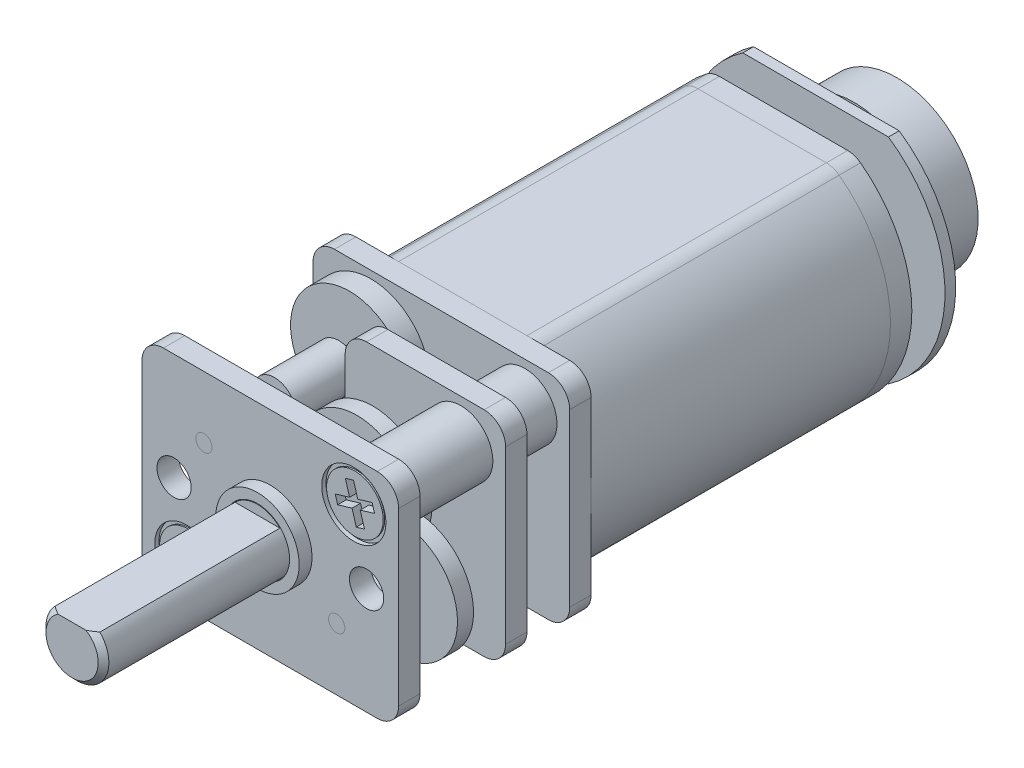
from build123d import *

# Parameters (mm, degrees)
BOSS_EXTRUDE1_DEPTH    = 7.5
FILLET3_R              = 1
BOSS_EXTRUDE2_DEPTH    = 1
BOSS_EXTRUDE3_START    = 9
BOSS_EXTRUDE3_DEPTH    = 1
SKETCH7_R              = 0.5
BOSS_EXTRUDE5_DEPTH    = 8
BOSS_EXTRUDE5_2_DEPTH  = 8
BOSS_EXTRUDE8_START    = 2
BOSS_EXTRUDE8_DEPTH    = 1
CUT_EXTRUDE1_START     = -9
SKETCH5_R              = 0.75
SKETCH5_R_2            = 0.38
CUT_EXTRUDE1_DEPTH     = 9
SKETCH8_R              = 0.5
SKETCH8_R_2            = 0.38
CUT_EXTRUDE2_DEPTH     = 1
BOSS_EXTRUDE6_START    = 0.2
SKETCH9_R              = 2.75
SKETCH9_R_2            = 0.5
BOSS_EXTRUDE6_DEPTH    = 1
BOSS_EXTRUDE16_START   = 0.1
SKETCH9_3_R            = 1
SKETCH9_3_R_2          = 0.75
BOSS_EXTRUDE16_DEPTH   = 1.3
SKETCH6_R              = 1.95
SKETCH6_R_2            = 0.75
BOSS_EXTRUDE4_DEPTH    = 0.6
BOSS_EXTRUDE7_START    = 0.5
SKETCH10_R             = 1
SKETCH10_R_2           = 0.5
BOSS_EXTRUDE7_DEPTH    = 3
SKETCH12_R             = 1.5
SKETCH12_R_2           = 0.75
BOSS_EXTRUDE9_DEPTH    = 2
BOSS_EXTRUDE9_2_DEPTH  = 2
BOSS_EXTRUDE10_START   = 3
SKETCH12_2_R           = 1.5
SKETCH12_2_R_2         = 0.75
BOSS_EXTRUDE10_DEPTH   = 4
BOSS_EXTRUDE10_2_DEPTH = 4
SKETCH13_R             = 1.5
CUT_EXTRUDE3_DEPTH     = 7.2
SKETCH14_R             = 1.5
CUT_EXTRUDE4_DEPTH     = 0.2
CHAMFER1_SIZE          = 0.5
BOSS_EXTRUDE11_START   = 0.2
SKETCH15_R             = 2.75
BOSS_EXTRUDE11_DEPTH   = 0.75
BOSS_EXTRUDE12_START   = 0.2
SKETCH16_R             = 1
BOSS_EXTRUDE12_DEPTH   = 1.15
BOSS_EXTRUDE13_START   = 0.4
SKETCH17_R             = 2.75
BOSS_EXTRUDE13_DEPTH   = 0.75
BOSS_EXTRUDE14_START   = 0.2
SKETCH18_R             = 1
BOSS_EXTRUDE14_DEPTH   = 1.5
SKETCH19_R             = 0.5
CUT_EXTRUDE5_DEPTH     = 25.100622399
SKETCH20_R             = 2.75
BOSS_EXTRUDE15_DEPTH   = 1
CUT_EXTRUDE6_START     = -22.8
SKETCH21_R             = 0.5
CUT_EXTRUDE6_DEPTH     = 24.6
CHAMFER2_SIZE          = 0.25
CUT_EXTRUDE7_DEPTH     = 8.67
SKETCH24_R             = 0.8
CUT_EXTRUDE8_DEPTH     = 1
CUT_EXTRUDE9_START     = -1
CUT_EXTRUDE9_DEPTH     = 1
BOSS_EXTRUDE17_DEPTH   = 1
SKETCH27_R             = 2.5
BOSS_EXTRUDE18_DEPTH   = 1.5
SKETCH28_W             = 0.3
SKETCH28_H             = 1.5
BOSS_EXTRUDE19_DEPTH   = 2
BOSS_EXTRUDE19_2_DEPTH = 2
FILLET1_R              = 0.7
FILLET2_R              = 0.7
CUT_EXTRUDE10_DEPTH    = 0.4
SKETCH31_R             = 0.5
BOSS_EXTRUDE20_DEPTH   = 4
SKETCH32_R             = 0.610179696
BOSS_EXTRUDE21_DEPTH   = 0.5
SKETCH33_R             = 3.8
BOSS_EXTRUDE22_DEPTH   = 2


with BuildPart() as part:
    # Sketch1 → Boss-Extrude1 (new, symmetric)
    with BuildSketch(Plane.XY):
        with BuildLine():
            Line((3.31662479, 5), (-3.31662479, 5))
            ThreePointArc((-3.31662479, 5), (-6, 0), (-3.31662479, -5))
            Line((-3.31662479, -5), (3.31662479, -5))
            ThreePointArc((3.31662479, -5), (6, 0), (3.31662479, 5))
        make_face()
    extrude(amount=BOSS_EXTRUDE1_DEPTH, both=True)

    # Fillet3
    fillet3_edges = [part.edges().sort_by_distance(p)[0] for p in [
        (3.31662479, -5, 0),
        (-3.31662479, -5, 0),
        (-3.31662479, 5, 0),
        (3.31662479, 5, 0),
    ]]
    fillet(fillet3_edges, radius=FILLET3_R)

    # Sketch25 → Cut-Extrude9 (cut)
    with BuildSketch(Plane(origin=(0, 0, -7.5), x_dir=(-1, 0, 0), z_dir=(0, 0, -1)).offset(CUT_EXTRUDE9_START)):
        with BuildLine():
            Line((-3, -5), (3, -5))
            ThreePointArc((3, -5), (3.316227766, -4.948683298), (3.6, -4.8))
            ThreePointArc((3.6, -4.8), (6, 0), (3.6, 4.8))
            ThreePointArc((3.6, 4.8), (3.316227766, 4.948683298), (3, 5))
            Line((3, 5), (-3, 5))
            ThreePointArc((-3, 5), (-3.316227766, 4.948683298), (-3.6, 4.8))
            ThreePointArc((-3.6, 4.8), (-6, 0), (-3.6, -4.8))
            ThreePointArc((-3.6, -4.8), (-3.316227766, -4.948683298), (-3, -5))
        make_face()
    extrude(amount=CUT_EXTRUDE9_DEPTH, mode=Mode.SUBTRACT)


with BuildPart() as body_2:
    # Sketch2 → Boss-Extrude2 (new body)
    with BuildSketch(Plane.XY.offset(7.5)):
        with BuildLine():
            Line((-5, -5), (5, -5))
            ThreePointArc((5, -5), (5.707106781, -4.707106781), (6, -4))
            Line((6, -4), (6, 4))
            ThreePointArc((6, 4), (5.707106781, 4.707106781), (5, 5))
            Line((5, 5), (-5, 5))
            ThreePointArc((-5, 5), (-5.707106781, 4.707106781), (-6, 4))
            Line((-6, 4), (-6, -4))
            ThreePointArc((-6, -4), (-5.707106781, -4.707106781), (-5, -5))
        make_face()
    extrude(amount=BOSS_EXTRUDE2_DEPTH)


with BuildPart() as body_3:
    # Sketch2<2> → Boss-Extrude3 (new body)
    with BuildSketch(Plane.XY.offset(7.5).offset(BOSS_EXTRUDE3_START)):
        with BuildLine():
            Line((-5, -5), (5, -5))
            ThreePointArc((5, -5), (5.707106781, -4.707106781), (6, -4))
            Line((6, -4), (6, 4))
            ThreePointArc((6, 4), (5.707106781, 4.707106781), (5, 5))
            Line((5, 5), (-5, 5))
            ThreePointArc((-5, 5), (-5.707106781, 4.707106781), (-6, 4))
            Line((-6, 4), (-6, -4))
            ThreePointArc((-6, -4), (-5.707106781, -4.707106781), (-5, -5))
        make_face()
    extrude(amount=-BOSS_EXTRUDE3_DEPTH)


with BuildPart() as body_4:
    # Sketch7 → Boss-Extrude5 (new body)
    with BuildSketch(Plane.XY.offset(8.5)):
        with Locations(Location((-3.104083332, 2.104083332, 0), (0, 0, 180))):
            Circle(SKETCH7_R)
    extrude(amount=BOSS_EXTRUDE5_DEPTH)


with BuildPart() as body_5:
    # Sketch7 → Boss-Extrude5 2 (new body)
    with BuildSketch(Plane.XY.offset(8.5)):
        with Locations(Location((3.104083332, -2.104083332, 0), (0, 0, 180))):
            Circle(SKETCH7_R)
    extrude(amount=BOSS_EXTRUDE5_2_DEPTH)


with BuildPart() as body_6:
    # Sketch11 → Boss-Extrude8 (new body)
    with BuildSketch(Plane.XY.offset(8.5).offset(BOSS_EXTRUDE8_START)):
        with BuildLine():
            Line((-5, -1.25), (-2.5, -1.25))
            ThreePointArc((-2.5, -1.25), (-1.792893219, -0.957106781), (-1.5, -0.25))
            Line((-1.5, -0.25), (-1.5, 4))
            ThreePointArc((-1.5, 4), (-1.207106781, 4.707106781), (-0.5, 5))
            Line((-0.5, 5), (5, 5))
            ThreePointArc((5, 5), (5.707106781, 4.707106781), (6, 4))
            Line((6, 4), (6, -4))
            ThreePointArc((6, -4), (5.707106781, -4.707106781), (5, -5))
            Line((5, -5), (-5, -5))
            ThreePointArc((-5, -5), (-5.707106781, -4.707106781), (-6, -4))
            Line((-6, -4), (-6, -2.25))
            ThreePointArc((-6, -2.25), (-5.707106781, -1.542893219), (-5, -1.25))
        make_face()
    extrude(amount=BOSS_EXTRUDE8_DEPTH)


with BuildPart() as cut_extrude1_tool:
    # Sketch5 → Cut-Extrude1 (new body)
    with BuildSketch(Plane.XY.offset(16.5).offset(CUT_EXTRUDE1_START)):
        Circle(SKETCH5_R)
        with Locations((-3.104083332, 2.104083332)):
            Circle(SKETCH5_R_2)
        with Locations((3.104083332, -2.104083332)):
            Circle(SKETCH5_R_2)
        with Locations((3.904344047, 3.123475238)):
            Circle(SKETCH5_R)
        with Locations((-3.904344047, -3.123475238)):
            Circle(SKETCH5_R)
    extrude(amount=CUT_EXTRUDE1_DEPTH)


with BuildPart() as body_2_1:
    add(body_2.part)

    # Cut-Extrude1: cut by cut_extrude1_tool
    add(cut_extrude1_tool.part, mode=Mode.SUBTRACT)


with BuildPart() as body_3_1:
    add(body_3.part)

    # Cut-Extrude1: cut by cut_extrude1_tool
    add(cut_extrude1_tool.part, mode=Mode.SUBTRACT)

    # Sketch6 → Boss-Extrude4 (add)
    with BuildSketch(Plane.XY.offset(16.5)):
        with Locations(Location((0, 0, 0), (0, 0, 180))):
            Circle(SKETCH6_R)
        Circle(SKETCH6_R_2, mode=Mode.SUBTRACT)
    extrude(amount=BOSS_EXTRUDE4_DEPTH)

    # Sketch13 → Cut-Extrude3 (cut)
    with BuildSketch(Plane.XY.offset(17.1)):
        Circle(SKETCH13_R)
    extrude(amount=-CUT_EXTRUDE3_DEPTH, mode=Mode.SUBTRACT)

    # Sketch14 → Cut-Extrude4 (cut)
    with BuildSketch(Plane.XY.offset(16.5)):
        with Locations(Location((3.904344047, 3.123475238, 0), (0, 0, 180))):
            Circle(SKETCH14_R)
        with Locations(Location((-3.904344047, -3.123475238, 0), (0, 0, 180))):
            Circle(SKETCH14_R)
    extrude(amount=-CUT_EXTRUDE4_DEPTH, mode=Mode.SUBTRACT)

    # Chamfer1
    chamfer1_edges = [body_3_1.edges().sort_by_distance(p)[0] for p in [
        (3.154344047, 3.123475238, 16.3),
        (-4.654344047, -3.123475238, 16.3),
    ]]
    chamfer(chamfer1_edges, length=CHAMFER1_SIZE)

    # Sketch24 → Cut-Extrude8 (cut)
    with BuildSketch(Plane.XY.offset(16.5)):
        with Locations((4.5, 0)):
            Circle(SKETCH24_R)
        with Locations((-4.5, 0)):
            Circle(SKETCH24_R)
    extrude(amount=-CUT_EXTRUDE8_DEPTH, mode=Mode.SUBTRACT)


with BuildPart() as body_6_1:
    add(body_6.part)

    # Cut-Extrude1: cut by cut_extrude1_tool
    add(cut_extrude1_tool.part, mode=Mode.SUBTRACT)


with BuildPart() as cut_extrude2_tool:
    # Sketch8 → Cut-Extrude2 (new body)
    # profile 1 of 2: a face of its own
    with BuildSketch(Plane.XY.offset(16.5)):
        with Locations((-3.104083332, 2.104083332)):
            Circle(SKETCH8_R)
        with Locations((-3.104083332, 2.104083332)):
            Circle(SKETCH8_R_2, mode=Mode.SUBTRACT)
    # profile 2 of 2: a face of its own
    with BuildSketch(Plane.XY.offset(16.5)):
        with Locations((3.104083332, -2.104083332)):
            Circle(SKETCH8_R)
        with Locations((3.104083332, -2.104083332)):
            Circle(SKETCH8_R_2, mode=Mode.SUBTRACT)
    extrude(amount=-CUT_EXTRUDE2_DEPTH)


with BuildPart() as body_4_1:
    add(body_4.part)

    # Cut-Extrude2: cut by cut_extrude2_tool
    add(cut_extrude2_tool.part, mode=Mode.SUBTRACT)


with BuildPart() as body_5_1:
    add(body_5.part)

    # Cut-Extrude2: cut by cut_extrude2_tool
    add(cut_extrude2_tool.part, mode=Mode.SUBTRACT)


with BuildPart() as body_7:
    # Sketch9 → Boss-Extrude6 (new body)
    with BuildSketch(Plane.XY.offset(8.5).offset(BOSS_EXTRUDE6_START)):
        with Locations((-3.104083332, 2.104083332)):
            Circle(SKETCH9_R)
        with Locations((-3.104083332, 2.104083332)):
            Circle(SKETCH9_R_2, mode=Mode.SUBTRACT)
    extrude(amount=BOSS_EXTRUDE6_DEPTH)


with BuildPart() as body_8:
    # Sketch9<3> → Boss-Extrude16 (new body)
    # profile 1 of 2: a face of its own
    with BuildSketch(Plane.XY.offset(8.5).offset(BOSS_EXTRUDE16_START)):
        Circle(SKETCH9_3_R)
        Circle(SKETCH9_3_R_2, mode=Mode.SUBTRACT)
    # profile 2 of 2: a face of its own
    with BuildSketch(Plane.XY.offset(8.5).offset(BOSS_EXTRUDE16_START)):
        Circle(SKETCH9_3_R_2)
    extrude(amount=BOSS_EXTRUDE16_DEPTH)


with BuildPart() as body_9:
    # Sketch10 → Boss-Extrude7 (new body)
    with BuildSketch(Plane.XY.offset(9.7).offset(BOSS_EXTRUDE7_START)):
        with Locations((-3.104083332, 2.104083332)):
            Circle(SKETCH10_R)
        with Locations((-3.104083332, 2.104083332)):
            Circle(SKETCH10_R_2, mode=Mode.SUBTRACT)
    extrude(amount=BOSS_EXTRUDE7_DEPTH)


with BuildPart() as body_10:
    # Sketch12 → Boss-Extrude9 (new body)
    with BuildSketch(Plane.XY.offset(8.5)):
        with Locations((-3.904344047, -3.123475238)):
            Circle(SKETCH12_R)
        with Locations((-3.904344047, -3.123475238)):
            Circle(SKETCH12_R_2, mode=Mode.SUBTRACT)
    extrude(amount=BOSS_EXTRUDE9_DEPTH)


with BuildPart() as body_11:
    # Sketch12 → Boss-Extrude9 2 (new body)
    with BuildSketch(Plane.XY.offset(8.5)):
        with Locations((3.904344047, 3.123475238)):
            Circle(SKETCH12_R)
        with Locations((3.904344047, 3.123475238)):
            Circle(SKETCH12_R_2, mode=Mode.SUBTRACT)
    extrude(amount=BOSS_EXTRUDE9_2_DEPTH)


with BuildPart() as body_12:
    # Sketch12<2> → Boss-Extrude10 (new body)
    with BuildSketch(Plane.XY.offset(8.5).offset(BOSS_EXTRUDE10_START)):
        with Locations(Location((-3.904344047, -3.123475238, 0), (0, 0, 180))):
            Circle(SKETCH12_2_R)
        with Locations(Location((-3.904344047, -3.123475238, 0), (0, 0, 180))):
            Circle(SKETCH12_2_R_2, mode=Mode.SUBTRACT)
    extrude(amount=BOSS_EXTRUDE10_DEPTH)


with BuildPart() as body_13:
    # Sketch12<2> → Boss-Extrude10 2 (new body)
    with BuildSketch(Plane.XY.offset(8.5).offset(BOSS_EXTRUDE10_START)):
        with Locations(Location((3.904344047, 3.123475238, 0), (0, 0, 180))):
            Circle(SKETCH12_2_R)
        with Locations(Location((3.904344047, 3.123475238, 0), (0, 0, 180))):
            Circle(SKETCH12_2_R_2, mode=Mode.SUBTRACT)
    extrude(amount=BOSS_EXTRUDE10_2_DEPTH)


with BuildPart() as body_14:
    # Sketch15 → Boss-Extrude11 (new body)
    with BuildSketch(Plane.XY.offset(11.5).offset(BOSS_EXTRUDE11_START)):
        Circle(SKETCH15_R)
    extrude(amount=BOSS_EXTRUDE11_DEPTH)


with BuildPart() as body_15:
    # Sketch16 → Boss-Extrude12 (new body)
    with BuildSketch(Plane.XY.offset(12.45).offset(BOSS_EXTRUDE12_START)):
        Circle(SKETCH16_R)
    extrude(amount=BOSS_EXTRUDE12_DEPTH)


with BuildPart() as body_16:
    # Sketch17 → Boss-Extrude13 (new body)
    with BuildSketch(Plane.XY.offset(12.45).offset(BOSS_EXTRUDE13_START)):
        with Locations((3.104083332, -2.104083332)):
            Circle(SKETCH17_R)
    extrude(amount=BOSS_EXTRUDE13_DEPTH)


with BuildPart() as body_17:
    # Sketch18 → Boss-Extrude14 (new body)
    with BuildSketch(Plane.XY.offset(13.6).offset(BOSS_EXTRUDE14_START)):
        with Locations((3.104083332, -2.104083332)):
            Circle(SKETCH18_R)
    extrude(amount=BOSS_EXTRUDE14_DEPTH)


with BuildPart() as cut_extrude5_tool:
    # Sketch19 → Cut-Extrude5 (new, through all)
    with BuildSketch(Plane.XY.offset(15.3)):
        with Locations((3.104083332, -2.104083332)):
            Circle(SKETCH19_R)
    extrude(amount=-CUT_EXTRUDE5_DEPTH)


with BuildPart() as body_17_1:
    add(body_17.part)

    # Cut-Extrude5: cut by cut_extrude5_tool
    add(cut_extrude5_tool.part, mode=Mode.SUBTRACT)


with BuildPart() as body_16_1:
    add(body_16.part)

    # Cut-Extrude5: cut by cut_extrude5_tool
    add(cut_extrude5_tool.part, mode=Mode.SUBTRACT)


with BuildPart() as body_6_2:
    add(body_6_1.part)

    # Cut-Extrude5: cut by cut_extrude5_tool
    add(cut_extrude5_tool.part, mode=Mode.SUBTRACT)


with BuildPart() as body_18:
    # Sketch20 → Boss-Extrude15 (new body)
    with BuildSketch(Plane.XY.offset(15.3)):
        Circle(SKETCH20_R)
    extrude(amount=-BOSS_EXTRUDE15_DEPTH)


with BuildPart() as cut_extrude6_tool:
    # Sketch21 → Cut-Extrude6 (new body)
    with BuildSketch(Plane.XY.offset(15.3).offset(CUT_EXTRUDE6_START)):
        Circle(SKETCH21_R)
    extrude(amount=CUT_EXTRUDE6_DEPTH)


with BuildPart() as body_14_1:
    add(body_14.part)

    # Cut-Extrude6: cut by cut_extrude6_tool
    add(cut_extrude6_tool.part, mode=Mode.SUBTRACT)


with BuildPart() as body_15_1:
    add(body_15.part)

    # Cut-Extrude6: cut by cut_extrude6_tool
    add(cut_extrude6_tool.part, mode=Mode.SUBTRACT)


with BuildPart() as body_18_1:
    add(body_18.part)

    # Cut-Extrude6: cut by cut_extrude6_tool
    add(cut_extrude6_tool.part, mode=Mode.SUBTRACT)


with BuildPart() as body_8_1:
    add(body_8.part)

    # Cut-Extrude6: cut by cut_extrude6_tool
    add(cut_extrude6_tool.part, mode=Mode.SUBTRACT)


with BuildPart() as body_19:
    # Sketch22 → Revolve1 (revolve)
    with BuildSketch(Plane(origin=(0, 0, 0), x_dir=(1, 0, 0), z_dir=(0, 1, 0))):
        Polygon((-0.5, -7.5), (-0.5, -15.3), (-1.47, -15.3), (-1.47, -25.77), (0, -25.77), (0, -7.5), align=None)
    revolve(axis=Axis((0, 0, 0), (0, 0, 1)))

    # Chamfer2
    chamfer2_edges = [body_19.edges().sort_by_distance(p)[0] for p in [
        (1.47, 0, 25.77),
    ]]
    chamfer(chamfer2_edges, length=CHAMFER2_SIZE)

    # Sketch23 → Cut-Extrude7 (cut)
    with BuildSketch(Plane.XY.offset(25.77)):
        with BuildLine():
            Line((1.048808848, 1.03), (-1.048808848, 1.03))
            ThreePointArc((-1.048808848, 1.03), (0, 1.47), (1.048808848, 1.03))
        make_face()
    extrude(amount=-CUT_EXTRUDE7_DEPTH, mode=Mode.SUBTRACT)


with BuildPart() as body_20:
    # Sketch26 → Boss-Extrude17 (new body)
    with BuildSketch(Plane(origin=(0, 0, -6.5), x_dir=(-1, 0, 0), z_dir=(0, 0, -1))):
        with BuildLine():
            Line((-3, -5), (3, -5))
            ThreePointArc((3, -5), (3.316227766, -4.948683298), (3.6, -4.8))
            ThreePointArc((3.6, -4.8), (6, 0), (3.6, 4.8))
            ThreePointArc((3.6, 4.8), (3.316227766, 4.948683298), (3, 5))
            Line((3, 5), (-3, 5))
            ThreePointArc((-3, 5), (-3.316227766, 4.948683298), (-3.6, 4.8))
            ThreePointArc((-3.6, 4.8), (-6, 0), (-3.6, -4.8))
            ThreePointArc((-3.6, -4.8), (-3.316227766, -4.948683298), (-3, -5))
        make_face()
    extrude(amount=BOSS_EXTRUDE17_DEPTH)

    # Sketch27 → Boss-Extrude18 (add)
    with BuildSketch(Plane(origin=(0, 0, -7.5), x_dir=(-1, 0, 0), z_dir=(0, 0, -1))):
        Circle(SKETCH27_R)
    extrude(amount=BOSS_EXTRUDE18_DEPTH)


with BuildPart() as body_21:
    # Sketch28 → Boss-Extrude19 (new body)
    with BuildSketch(Plane(origin=(0, 0, -7.5), x_dir=(-1, 0, 0), z_dir=(0, 0, -1))):
        with Locations((3.5, 0)):
            Rectangle(SKETCH28_W, SKETCH28_H)
    extrude(amount=BOSS_EXTRUDE19_DEPTH)

    # Fillet1
    fillet1_edges = [body_21.edges().sort_by_distance(p)[0] for p in [
        (-3.5, -0.75, -9.5),
        (-3.5, 0.75, -9.5),
    ]]
    fillet(fillet1_edges, radius=FILLET1_R)


with BuildPart() as body_22:
    # Sketch28 → Boss-Extrude19 2 (new body)
    with BuildSketch(Plane(origin=(0, 0, -7.5), x_dir=(-1, 0, 0), z_dir=(0, 0, -1))):
        with Locations((-3.5, 0)):
            Rectangle(SKETCH28_W, SKETCH28_H)
    extrude(amount=BOSS_EXTRUDE19_2_DEPTH)

    # Fillet2
    fillet2_edges = [body_22.edges().sort_by_distance(p)[0] for p in [
        (3.5, -0.75, -9.5),
        (3.5, 0.75, -9.5),
    ]]
    fillet(fillet2_edges, radius=FILLET2_R)


with BuildPart() as body_23:
    # Sketch29 → Revolve2 (revolve)
    with BuildSketch(Plane(origin=(0, 0, 0), x_dir=(0.7808688094430303, 0.6246950475544244, 0), z_dir=(0.6246950475544244, -0.7808688094430304, 0)), mode=Mode.PRIVATE) as revolve2_sk:
        Polygon((5.7, 7.5), (5.7, 15.755), (6.325, 16.38), (6.325, 16.45), (5, 16.45), (5, 7.5), align=None)
    revolve(revolve2_sk.sketch.rotate(Axis((3.904344047, 3.123475238, 16.5), (0, 0, 1)), 141.340191746), axis=Axis((3.904344047, 3.123475238, 16.5), (0, 0, 1)))


with BuildPart() as body_24:
    # Sketch29<3> → Revolve3 (revolve)
    with BuildSketch(Plane(origin=(0, 0, 0), x_dir=(0.7808688094430303, 0.6246950475544244, 0), z_dir=(0.6246950475544244, -0.7808688094430304, 0)), mode=Mode.PRIVATE) as revolve3_sk:
        Polygon((-5.7, 7.5), (-5.7, 15.755), (-6.325, 16.38), (-6.325, 16.45), (-5, 16.45), (-5, 7.5), align=None)
    revolve(revolve3_sk.sketch.rotate(Axis((-3.904344047, -3.123475238, 16.5), (0, 0, 1)), 321.340191746), axis=Axis((-3.904344047, -3.123475238, 16.5), (0, 0, 1)))


with BuildPart() as cut_extrude10_tool:
    # Sketch30 → Cut-Extrude10 (new body)
    with BuildSketch(Plane.XY.offset(16.45)):
        Polygon((-3.774222132, -2.210749492), (-4.020996733, -2.865808494), (-4.676055735, -2.619033892), (-4.817069793, -2.993353322), (-4.162010791, -3.240127924), (-4.408785393, -3.895186926), (-4.034465963, -4.036200984), (-3.787691361, -3.381141982), (-3.132632359, -3.627916583), (-2.991618301, -3.253597153), (-3.646677303, -3.006822552), (-3.399902702, -2.35176355), align=None)
        Polygon((3.456494168, 3.929347737), (3.65569802, 3.258290493), (2.984640775, 3.059086641), (3.098471548, 2.675625358), (3.769528792, 2.87482921), (3.968732644, 2.203771966), (4.352193927, 2.317602738), (4.152990075, 2.988659983), (4.824047319, 3.187863835), (4.710216547, 3.571325117), (4.039159302, 3.372121265), (3.83995545, 4.04317851), align=None)
    extrude(amount=-CUT_EXTRUDE10_DEPTH)


with BuildPart() as body_23_1:
    add(body_23.part)

    # Cut-Extrude10: cut by cut_extrude10_tool
    add(cut_extrude10_tool.part, mode=Mode.SUBTRACT)


with BuildPart() as body_24_1:
    add(body_24.part)

    # Cut-Extrude10: cut by cut_extrude10_tool
    add(cut_extrude10_tool.part, mode=Mode.SUBTRACT)


with BuildPart() as body_25:
    # Sketch31 → Boss-Extrude20 (new body)
    with BuildSketch(Plane(origin=(0, 0, -9), x_dir=(-1, 0, 0), z_dir=(0, 0, -1))):
        Circle(SKETCH31_R)
    extrude(amount=BOSS_EXTRUDE20_DEPTH)


with BuildPart() as body_26:
    # Sketch32 → Boss-Extrude21 (new body)
    with BuildSketch(Plane(origin=(0, 0, -9), x_dir=(-1, 0, 0), z_dir=(0, 0, -1))):
        with BuildLine():
            ThreePointArc((-3.406244266, 5), (-6.05, 0), (-3.406244266, -5))
            Line((-3.406244266, -5), (3.406244266, -5))
            ThreePointArc((3.406244266, -5), (5.348377222, -2.827960589), (6.05, 0))
            ThreePointArc((6.05, 0), (5.348377222, 2.827960589), (3.406244266, 5))
            Line((3.406244266, 5), (-3.406244266, 5))
        make_face()
        Circle(SKETCH32_R, mode=Mode.SUBTRACT)
    extrude(amount=BOSS_EXTRUDE21_DEPTH)


with BuildPart() as body_27:
    # Sketch33 → Boss-Extrude22 (new body)
    with BuildSketch(Plane(origin=(0, 0, -10.8), x_dir=(-1, 0, 0), z_dir=(0, 0, -1))):
        Circle(SKETCH33_R)
    extrude(amount=BOSS_EXTRUDE22_DEPTH)


solid = Compound([part.part, body_2_1.part, body_3_1.part, body_4_1.part, body_5_1.part, body_7.part, body_9.part, body_10.part, body_11.part, body_12.part, body_13.part, body_17_1.part, body_16_1.part, body_6_2.part, body_14_1.part, body_15_1.part, body_18_1.part, body_8_1.part, body_19.part, body_20.part, body_21.part, body_22.part, body_23_1.part, body_24_1.part, body_25.part, body_26.part, body_27.part])
